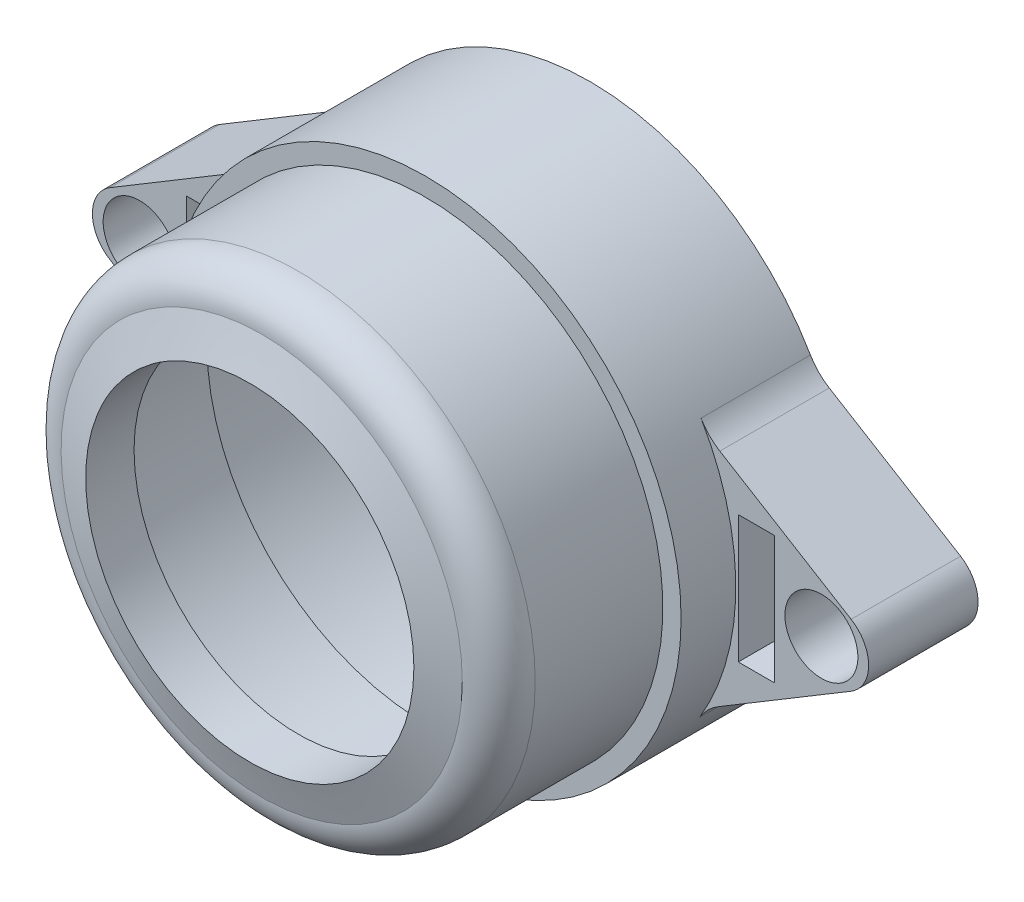
from build123d import *

# Parameters (mm, degrees)
SKETCH1_R                = 14
BOSS_EXTRUDE1_DEPTH      = 9
SKETCH2_R                = 13
BOSS_EXTRUDE2_DEPTH      = 9
FILLET1_R                = 2
SKETCH3_R                = 8
BOSS_EXTRUDE4_DEPTH      = 1
BOSS_EXTRUDE5_DEPTH      = 6
SKETCH6_R                = 2
CUT_EXTRUDE1_DEPTH       = 6
FILLET2_R                = 2
SKETCH7_W                = 2
SKETCH7_H                = 7
CUT_EXTRUDE2_DEPTH       = 6
SKETCH9_R                = 1
BOSS_EXTRUDE7_DEPTH      = 3
FILLET5_R                = 1
FILLET6_R                = 3
SKETCH18_W               = 3.964192534
SKETCH18_H               = 7
CUT_EXTRUDE3_DEPTH       = 3
SKETCH19_W               = 1
SKETCH19_H               = 3.03788609
BOSS_EXTRUDE8_DEPTH      = 2
CIRPATTERN2_COUNT        = 2
FILLET2_OF_CIRPATTERN2_R = 2
FILLET5_OF_CIRPATTERN2_R = 1
FILLET6_OF_CIRPATTERN2_R = 3
SKETCH10_R               = 13
CUT_EXTRUDE4_DEPTH       = 9
SKETCH20_R               = 12
CUT_EXTRUDE6_DEPTH       = 7
SKETCH17_R               = 9
CUT_EXTRUDE7_DEPTH       = 7


with BuildPart() as part:
    # Sketch1 → Boss-Extrude1 (new body)
    with BuildSketch(Plane.XY):
        Circle(SKETCH1_R)
    extrude(amount=BOSS_EXTRUDE1_DEPTH)

    # Sketch2 → Boss-Extrude2 (add)
    with BuildSketch(Plane.XY.offset(9)):
        Circle(SKETCH2_R)
    extrude(amount=BOSS_EXTRUDE2_DEPTH)

    # Fillet1
    fillet1_edges = [part.edges().sort_by_distance(p)[0] for p in [
        (-13, 0, 18),
    ]]
    fillet(fillet1_edges, radius=FILLET1_R)

    # Sketch3 → Boss-Extrude4 (add)
    with BuildSketch(Plane.XY.offset(18)):
        Circle(SKETCH3_R)
    extrude(amount=BOSS_EXTRUDE4_DEPTH)

    # Loft2: read off the stored shape, not the designer's step
    # Loft2: loft between two sections, ruled curve by curve
    loft2_from = [
        Edge.make_bspline([(5.248893728, -6.037310215, 19), (-6.825726701, -16.535097672, 19), (-17.323514158, -4.460477242, 19), (-5.248893728, 6.037310215, 19), (6.825726701, 16.535097672, 19), (17.323514158, 4.460477242, 19), (5.248893728, -6.037310215, 19)], [0, 0, 0, 0, 0.5, 0.5, 0.5, 1, 1, 1, 1], 3, [1, 0.333333333, 0.333333333, 1, 0.333333333, 0.333333333, 1]),
    ]
    loft2_to = [
        Edge.make_bspline([(8.70017049, -6.731049951, 18), (-4.761929412, -24.131390931, 18), (-22.162270392, -10.669291029, 18), (-8.70017049, 6.731049951, 18), (4.761929412, 24.131390931, 18), (22.162270392, 10.669291029, 18), (8.70017049, -6.731049951, 18)], [0, 0, 0, 0, 0.5, 0.5, 0.5, 1, 1, 1, 1], 3, [1, 0.333333333, 0.333333333, 1, 0.333333333, 0.333333333, 1]),
    ]
    loft2 = Solid(Shell([*[Face.make_surface_from_curves(loft2_from[k], loft2_to[k]) for k in range(1)], Face(Wire(loft2_from)), Face(Wire(loft2_to))]))
    add(loft2)

    # Sketch5 → Boss-Extrude5 (add)
    with BuildSketch(Plane.XY):
        Polygon((0, 14), (-23.146959422, 0.099702538), (0, -14), align=None)
    boss_extrude5 = extrude(amount=BOSS_EXTRUDE5_DEPTH)

    # Sketch6 → Cut-Extrude1 (cut)
    with BuildSketch(Plane.XY.offset(6)):
        with Locations((-18.691655648, 0)):
            Circle(SKETCH6_R)
    cut_extrude1 = extrude(amount=-CUT_EXTRUDE1_DEPTH, mode=Mode.SUBTRACT)

    # Fillet2
    fillet2_edges = [part.edges().sort_by_distance(p)[0] for p in [
        (-23.146959422, 0.099702538, 3),
    ]]
    fillet(fillet2_edges, radius=FILLET2_R)

    # Sketch7 → Cut-Extrude2 (cut)
    with BuildSketch(Plane.XY.offset(6)):
        with Locations((-15.134010952, 0)):
            Rectangle(SKETCH7_W, SKETCH7_H)
    cut_extrude2 = extrude(amount=-CUT_EXTRUDE2_DEPTH, mode=Mode.SUBTRACT)

    # Sketch9 → Boss-Extrude7 (add)
    with BuildSketch(Plane(origin=(0, 0, 0), x_dir=(-1, 0, 0), z_dir=(0, 0, -1))):
        with Locations(Location((13.108195975, 4.846616093, 0), (0, 0, 180))):
            Circle(SKETCH9_R)
    boss_extrude7 = extrude(amount=BOSS_EXTRUDE7_DEPTH)

    # Fillet5
    fillet5_edges = [part.edges().sort_by_distance(p)[0] for p in [
        (-14.108195975, 4.846616093, -3),
    ]]
    fillet(fillet5_edges, radius=FILLET5_R)

    # Fillet6
    fillet6_edges = [part.edges().sort_by_distance(p)[0] for p in [
        (-12.358010146, 6.578722158, 3),
        (-12.440013632, -6.422309618, 3),
    ]]
    fillet(fillet6_edges, radius=FILLET6_R)

    # Sketch18 → Cut-Extrude3 (cut)
    with BuildSketch(Plane.ZY.offset(14.134010952)):
        with Locations((0.837060151, 0)):
            Rectangle(SKETCH18_W, SKETCH18_H)
    cut_extrude3 = extrude(amount=-CUT_EXTRUDE3_DEPTH, mode=Mode.SUBTRACT)

    # Sketch19 → Boss-Extrude8 (add)
    with BuildSketch(Plane(origin=(-16.134010952, 0, 0), x_dir=(0, 0, -1), z_dir=(1, 0, 0))):
        with Locations((-0.5, 1.981056955)):
            Rectangle(SKETCH19_W, SKETCH19_H)
    boss_extrude8 = extrude(amount=BOSS_EXTRUDE8_DEPTH)

    # CirPattern2: Boss-Extrude5, Cut-Extrude1, Cut-Extrude2, Boss-Extrude7, Cut-Extrude3, Boss-Extrude8 ×2 about axis
    cirpattern2_axis = Axis((0, 0, 0), (0, 0, 1))
    add([boss_extrude5.rotate(cirpattern2_axis, i * 360 / CIRPATTERN2_COUNT) for i in range(1, CIRPATTERN2_COUNT)])
    add([cut_extrude1.rotate(cirpattern2_axis, i * 360 / CIRPATTERN2_COUNT) for i in range(1, CIRPATTERN2_COUNT)], mode=Mode.SUBTRACT)
    add([cut_extrude2.rotate(cirpattern2_axis, i * 360 / CIRPATTERN2_COUNT) for i in range(1, CIRPATTERN2_COUNT)], mode=Mode.SUBTRACT)
    add([boss_extrude7.rotate(cirpattern2_axis, i * 360 / CIRPATTERN2_COUNT) for i in range(1, CIRPATTERN2_COUNT)])
    add([cut_extrude3.rotate(cirpattern2_axis, i * 360 / CIRPATTERN2_COUNT) for i in range(1, CIRPATTERN2_COUNT)], mode=Mode.SUBTRACT)
    add([boss_extrude8.rotate(cirpattern2_axis, i * 360 / CIRPATTERN2_COUNT) for i in range(1, CIRPATTERN2_COUNT)])

    # Fillet2 of CirPattern2
    fillet2_of_cirpattern2_edges = [part.edges().sort_by_distance(p)[0] for p in [
        (23.146959422, -0.099702538, 3),
    ]]
    fillet(fillet2_of_cirpattern2_edges, radius=FILLET2_OF_CIRPATTERN2_R)

    # Fillet5 of CirPattern2
    fillet5_of_cirpattern2_edges = [part.edges().sort_by_distance(p)[0] for p in [
        (14.108195975, -4.846616093, -3),
    ]]
    fillet(fillet5_of_cirpattern2_edges, radius=FILLET5_OF_CIRPATTERN2_R)

    # Fillet6 of CirPattern2
    fillet6_of_cirpattern2_edges = [part.edges().sort_by_distance(p)[0] for p in [
        (12.358010146, -6.578722158, 3),
        (12.440013632, 6.422309618, 3),
    ]]
    fillet(fillet6_of_cirpattern2_edges, radius=FILLET6_OF_CIRPATTERN2_R)

    # Sketch10 → Cut-Extrude4 (cut)
    with BuildSketch(Plane(origin=(0, 0, 0), x_dir=(-1, 0, 0), z_dir=(0, 0, -1))):
        Circle(SKETCH10_R)
    extrude(amount=-CUT_EXTRUDE4_DEPTH, mode=Mode.SUBTRACT)


with BuildPart() as cut_extrude4_piece_1:
    # of the separate pieces the step leaves, piece 1, a body of its own (cut_extrude4_pieces)
    add(part.part.solids().sort_by_distance((13, 0, 16))[0])

    # Sketch20 → Cut-Extrude6 (cut)
    with BuildSketch(Plane(origin=(0, 0, 9), x_dir=(-1, 0, 0), z_dir=(0, 0, -1))):
        Circle(SKETCH20_R)
    extrude(amount=-CUT_EXTRUDE6_DEPTH, mode=Mode.SUBTRACT)

    # Sketch17 → Cut-Extrude7 (cut)
    with BuildSketch(Plane.XY.offset(19)):
        with Locations(Location((0, 0, 0), (0, 0, 315.765085114))):
            Circle(SKETCH17_R)
    extrude(amount=-CUT_EXTRUDE7_DEPTH, mode=Mode.SUBTRACT)


with BuildPart() as cut_extrude4_piece_2:
    # of the separate pieces the step leaves, piece 2, a body of its own (cut_extrude4_pieces)
    add(part.part.solids().sort_by_distance((13.033943153, -6.172808375, 0))[0])


solid = Compound([cut_extrude4_piece_1.part, cut_extrude4_piece_2.part])
